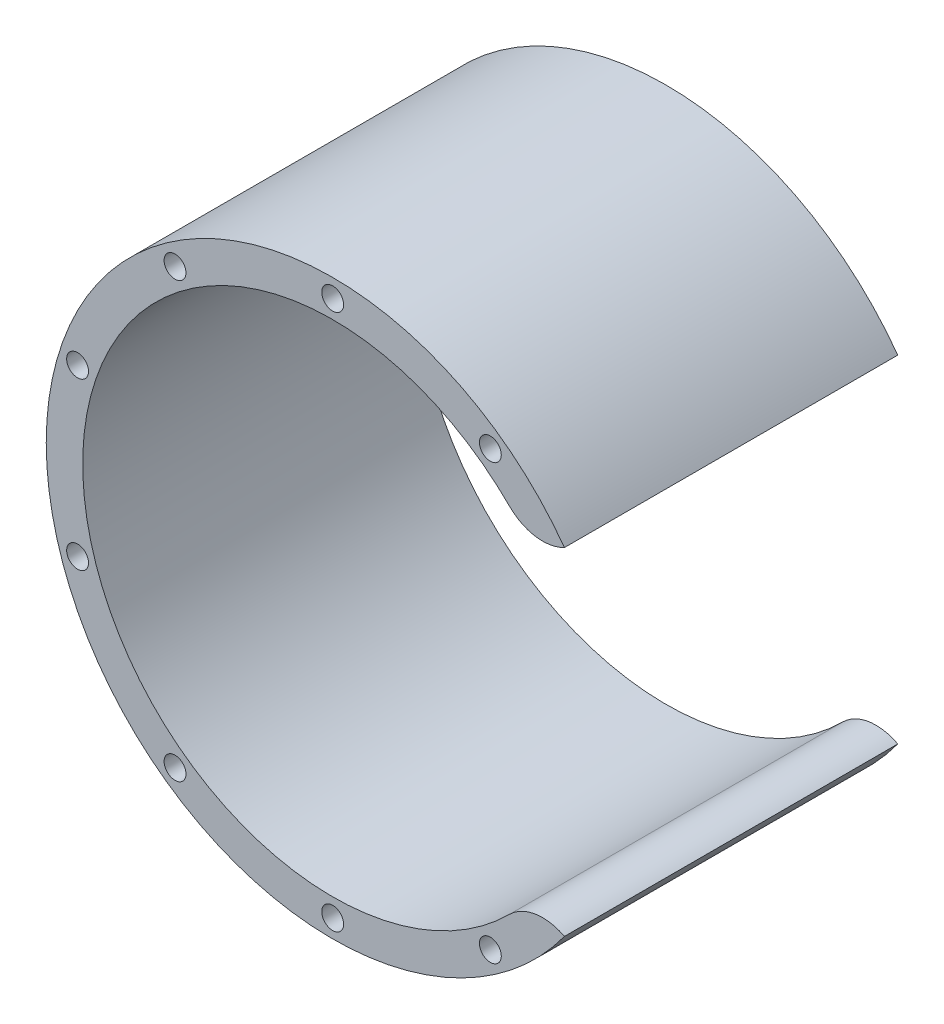
from build123d import *

# Parameters (mm, degrees)
ESQUISSE1_R             = 55
ESQUISSE1_R_2           = 48
ESQUISSE1_R_3           = 2.1
BOSS_EXTRU_1_DEPTH      = 64
ENL_V_MAT_EXTRU_1_DEPTH = 101.727354775
CONG_1_R                = 9


with BuildPart() as part:
    # Esquisse1 → Boss.-Extru.1 (new body)
    with BuildSketch(Plane.XY):
        Circle(ESQUISSE1_R)
        Circle(ESQUISSE1_R_2, mode=Mode.SUBTRACT)
        with Locations((0, 51.5)):
            Circle(ESQUISSE1_R_3, mode=Mode.SUBTRACT)
        with Locations((30.270940493, 41.66437521)):
            Circle(ESQUISSE1_R_3, mode=Mode.SUBTRACT)
        with Locations((48.979410589, 15.91437521)):
            Circle(ESQUISSE1_R_3, mode=Mode.SUBTRACT)
        with Locations((48.979410589, -15.91437521)):
            Circle(ESQUISSE1_R_3, mode=Mode.SUBTRACT)
        with Locations((30.270940493, -41.66437521)):
            Circle(ESQUISSE1_R_3, mode=Mode.SUBTRACT)
        with Locations((0, -51.5)):
            Circle(ESQUISSE1_R_3, mode=Mode.SUBTRACT)
        with Locations((-30.270940493, -41.66437521)):
            Circle(ESQUISSE1_R_3, mode=Mode.SUBTRACT)
        with Locations((-48.979410589, -15.91437521)):
            Circle(ESQUISSE1_R_3, mode=Mode.SUBTRACT)
        with Locations((-48.979410589, 15.91437521)):
            Circle(ESQUISSE1_R_3, mode=Mode.SUBTRACT)
        with Locations((-30.270940493, 41.66437521)):
            Circle(ESQUISSE1_R_3, mode=Mode.SUBTRACT)
    extrude(amount=BOSS_EXTRU_1_DEPTH)

    # Esquisse3 → Enlèv. mat.-Extru.1 (cut, through all)
    with BuildSketch(Plane.XY.offset(64)):
        Polygon((0, 0), (60, 43.59255168), (60, -43.59255168), align=None)
    extrude(amount=-ENL_V_MAT_EXTRU_1_DEPTH, mode=Mode.SUBTRACT)

    # Congé1
    # the kernel refuses this fillet: 9 mm, written as the material it takes off along each edge
    with BuildSketch(Plane(origin=(38.83281573, -28.21369211, 82.806493839), x_dir=(0.809016994374856, -0.5877852522925988, 0), z_dir=(0, 0, -1))) as cong_1_piece_1:
        with BuildLine():
            CenterArc((8.3, 8.905616206), CONG_1_R, 188.98865434, 72.706236132)
            Line((-0.589473684, 7.499466278), (-0.767263158, 7.47134328))
            ThreePointArc((-0.767263158, 7.47134328), (-0.327041859, 3.747193897), (-0.18, 0))
            Line((-0.18, 0), (0, -0.18))
            ThreePointArc((0, -0.18), (3.5, -0.18), (6.974, -0.178112324))
            Line((6.974, -0.178112324), (7, 0))
        make_face()
    extrude(amount=101.612987679, mode=Mode.SUBTRACT)
    with BuildSketch(Plane(origin=(38.83281573, 28.21369211, 82.806493839), x_dir=(0.8090169943748586, 0.5877852522925953, 0), z_dir=(0, 0, -1))) as cong_1_piece_2:
        with BuildLine():
            CenterArc((8.3, -8.905616206), CONG_1_R, 98.305109528, 72.706236132)
            Line((-0.589473684, -7.499466278), (-0.767263158, -7.47134328))
            ThreePointArc((-0.767263158, -7.47134328), (-0.327041859, -3.747193897), (-0.18, 0))
            Line((-0.18, 0), (0, 0.18))
            ThreePointArc((0, 0.18), (3.5, 0.18), (6.974, 0.178112324))
            Line((6.974, 0.178112324), (7, 0))
        make_face()
    extrude(amount=101.612987679, mode=Mode.SUBTRACT)


solid = part.part
